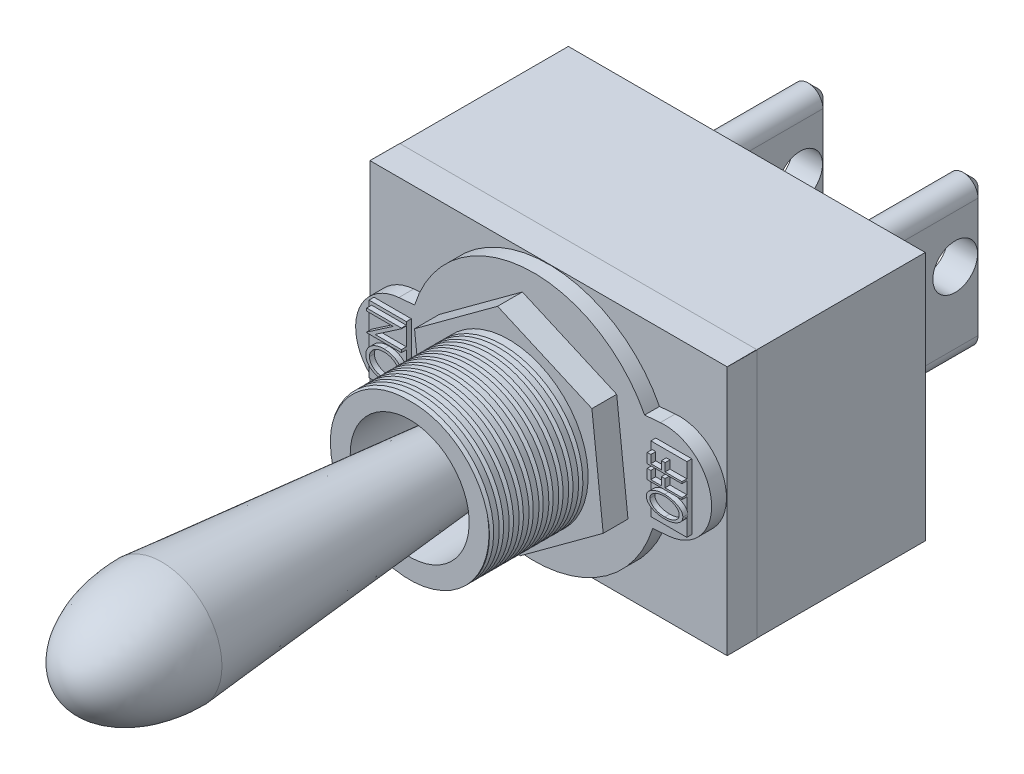
from build123d import *

# Parameters (mm, degrees)
CROQUIS1_R               = 3
SALIENTE_EXTRUIR1_DEPTH  = 35
SALIENTE_EXTRUIR1_DRAFT  = -5
CROQUIS2_R               = 8
CROQUIS2_R_2             = 6
SALIENTE_EXTRUIR2_DEPTH  = 10
CROQUIS3_R               = 8
SALIENTE_EXTRUIR3_DEPTH  = 2.5
SALIENTE_EXTRUIR4_DEPTH  = 1.5
CROQUIS5_W               = 3.766398957
CROQUIS5_H               = 6.782221943
CROQUIS5_W_2             = 3.62908354
CROQUIS5_H_2             = 6.615171576
SALIENTE_EXTRUIR5_DEPTH  = 0.5
SALIENTE_EXTRUIR6_DEPTH  = 0.5
SALIENTE_EXTRUIR7_DEPTH  = 0.5
CROQUIS10_W              = 36
CROQUIS10_H              = 25.196096164
SALIENTE_EXTRUIR8_DEPTH  = 20
CROQUIS11_W              = 36
CROQUIS11_H              = 3
SALIENTE_EXTRUIR9_DEPTH  = 0.02
SALIENTE_EXTRUIR10_DEPTH = 0.02
SALIENTE_EXTRUIR11_DEPTH = 0.02
SALIENTE_EXTRUIR12_DEPTH = 0.02
SALIENTE_EXTRUIR13_DEPTH = 15
CROQUIS17_R              = 2.256557715
CORTAR_EXTRUIR1_DEPTH    = 20
CHAFL_N1_SIZE            = 1
CORTAR_BARRER1_PITCH     = 1


with BuildPart() as part:
    # Croquis1 → Saliente-Extruir1 (with draft: the straight prism first)
    with BuildSketch(Plane.XY):
        Circle(CROQUIS1_R)
    extrude(amount=SALIENTE_EXTRUIR1_DEPTH)
    # Saliente-Extruir1: the draft: its side faces are tilted about the plane it starts from
    saliente_extruir1_sides = [part.faces().sort_by_distance(p)[0] for p in [
        (-3, 0, 17.5),
    ]]
    draft(saliente_extruir1_sides, Plane.XY, SALIENTE_EXTRUIR1_DRAFT)

    # Cúpula1: read off the stored shape, not the designer's step
    # Cúpula1 outline → Cúpula1 (revolve)
    with BuildSketch(Plane.XZ):
        with BuildLine():
            add(Edge.make_bspline(
                [(0, 45), (6.062103223, 45), (6.062103223, 35)],
                knots=[0, 0, 0, 1.570796327, 1.570796327, 1.570796327], degree=2, weights=[1, 0.707106781, 1]))
            Line((0, 45), (0, 35))
            Line((0, 35), (6.062103223, 35))
        make_face()
    revolve(axis=Axis((0, 0, 0), (0, 0, 1)))


with BuildPart() as body_2:
    # Croquis2 → Saliente-Extruir2 (new body)
    with BuildSketch(Plane(origin=(0, 0, 0), x_dir=(-1, 0, 0), z_dir=(0, 0, -1))):
        Circle(CROQUIS2_R)
        Circle(CROQUIS2_R_2, mode=Mode.SUBTRACT)
    extrude(amount=-SALIENTE_EXTRUIR2_DEPTH)

    # Cortar-Barrer1: arcs per turn and ends read off the stored shape
    # Cortar-Barrer1: the profile of Croquis20 screwed along a right-hand helix through 10 turns, 8 arcs to a turn; built about Z, then put on its axis
    cortar_barrer1_z = Axis((0, 0, 0), (0, 0, 1))
    cortar_barrer1_corners = [(7.627492064, 0, -0.5), (8.186253968, 0, -0.177398664), (8.186253968, 0, -0.822601336)]
    with BuildLine(mode=Mode.PRIVATE) as cortar_barrer1_profile:
        Line(cortar_barrer1_corners[0], cortar_barrer1_corners[1])
        Line(cortar_barrer1_corners[1], cortar_barrer1_corners[2])
        Line(cortar_barrer1_corners[2], cortar_barrer1_corners[0])
    cortar_barrer1_cap = Face(cortar_barrer1_profile.wire())
    cortar_barrer1_turn_angles = [0, 22.5, 45, 67.5, 90, 112.5, 135, 157.5, 180, 202.5, 225, 247.5, 270, 292.5, 315, 337.5, 360]
    cortar_barrer1_turn_weights = [1, 0.9238795325112867, 1, 0.9238795325112867, 1, 0.9238795325112867, 1, 0.9238795325112867, 1, 0.9238795325112867, 1, 0.9238795325112867, 1, 0.9238795325112867, 1, 0.9238795325112867, 1]
    cortar_barrer1_turn_rails = [Edge.make_bspline([Vector(p[0], p[1], 0).rotate(cortar_barrer1_z, cortar_barrer1_turn_angles[k]) / cortar_barrer1_turn_weights[k] + Vector(0, 0, p[2] + CORTAR_BARRER1_PITCH * cortar_barrer1_turn_angles[k] / 360) for k in range(17)], [0, 0, 0, 1, 1, 2, 2, 3, 3, 4, 4, 5, 5, 6, 6, 7, 7, 8, 8, 8], 2, cortar_barrer1_turn_weights) for p in cortar_barrer1_corners]
    cortar_barrer1_turn_sides = [Face.make_surface_from_curves(cortar_barrer1_turn_rails[p[0]], cortar_barrer1_turn_rails[p[1]]) for p in [(0, 1), (1, 2), (2, 0)]]
    cortar_barrer1 = Plane(origin=(0, 0, 10), x_dir=(0, -1, 0), z_dir=(0, 0, -1)) * Solid(Shell([*[p.moved(Location((0, 0, CORTAR_BARRER1_PITCH * i))) for i in range(10) for p in cortar_barrer1_turn_sides], cortar_barrer1_cap, cortar_barrer1_cap.rotate(cortar_barrer1_z, 3600).moved(Location((0, 0, CORTAR_BARRER1_PITCH * 3600 / 360)))]))
    add(cortar_barrer1, mode=Mode.SUBTRACT)


with BuildPart() as body_3:
    # Croquis3 → Saliente-Extruir3 (new body)
    with BuildSketch(Plane(origin=(0, 0, 0), x_dir=(-1, 0, 0), z_dir=(0, 0, -1))):
        Polygon((8.37751484, -6.149572758), (9.514443651, 4.180354293), (1.136928811, 10.329927051), (-8.37751484, 6.149572758), (-9.514443651, -4.180354293), (-1.136928811, -10.329927051), align=None)
        Circle(CROQUIS3_R, mode=Mode.SUBTRACT)
    extrude(amount=SALIENTE_EXTRUIR3_DEPTH)

    # Croquis4 → Saliente-Extruir4 (add)
    with BuildSketch(Plane(origin=(0, 0, -2.5), x_dir=(-1, 0, 0), z_dir=(0, 0, -1))):
        with BuildLine():
            Line((12.779751535, -5.879948052), (11.193935977, -5.743837419))
            ThreePointArc((11.193935977, -5.743837419), (-1.075920926, -12.535480251), (-12.008992426, -3.752328859))
            Line((-12.008992426, -3.752328859), (-13.594807984, -3.616218227))
            ThreePointArc((-13.594807984, -3.616218227), (-17.935362899, 1.539393137), (-12.779751535, 5.879948052))
            Line((-12.779751535, 5.879948052), (-11.193935977, 5.743837419))
            ThreePointArc((-11.193935977, 5.743837419), (1.075920926, 12.535480251), (12.008992426, 3.752328859))
            Line((12.008992426, 3.752328859), (13.594807984, 3.616218227))
            ThreePointArc((13.594807984, 3.616218227), (17.935362899, -1.539393137), (12.779751535, -5.879948052))
        make_face()
    extrude(amount=SALIENTE_EXTRUIR4_DEPTH)

    # Croquis5 → Saliente-Extruir5 (add)
    with BuildSketch(Plane.XY.offset(-2.5)):
        with Locations((-14.220250049, -1.001220863)):
            Rectangle(CROQUIS5_W, CROQUIS5_H)
        with Locations((14.141947096, 0.9957077)):
            Rectangle(CROQUIS5_W_2, CROQUIS5_H_2)
    extrude(amount=SALIENTE_EXTRUIR5_DEPTH)

    # Croquis8 → Saliente-Extruir6 (add)
    # profile 1 of 2: a face of its own
    with BuildSketch(Plane.XY.offset(-2)):
        Polygon((-12.33705057, -0.078058609), (-15.83705057, -0.078058609), (-15.83705057, -0.021267744), (-13.167879897, 1.806556775), (-15.83705057, 1.806556775), (-15.83705057, 2.075787544), (-12.33705057, 2.075787544), (-12.33705057, 2.014789948), (-14.999210026, 0.19117216), (-12.33705057, 0.19117216), align=None)
    # profile 2 of 2: a face of its own
    with BuildSketch(Plane.XY.offset(-2)):
        with BuildLine():
            add(Edge.make_bspline(
                [(-15.92679416, -2.047509731), (-15.925167912, -1.997630162), (-15.921963876, -1.899357345), (-15.896835646, -1.755178861), (-15.855169298, -1.617233023), (-15.79685654, -1.485354226), (-15.720537577, -1.360527098), (-15.629222835, -1.241238934), (-15.519784347, -1.129731157), (-15.396637046, -1.024461777), (-15.26068879, -0.929355122), (-15.115757115, -0.8454956), (-14.963131297, -0.774726201), (-14.803117743, -0.715987564), (-14.635266777, -0.671276221), (-14.459547522, -0.640267122), (-14.276604668, -0.619757887), (-14.151844327, -0.617610997), (-14.088452814, -0.616520148)],
                knots=[0, 0, 0, 0, 0.924023764, 1.820513268, 2.70292414, 3.589068843, 4.484898936, 5.408394687, 6.367133157, 7.374840499, 8.407047113, 9.437461978, 10.474166088, 11.521026438, 12.592672644, 13.688629845, 14.825578305, 16, 16, 16, 16], degree=3))
            add(Edge.make_bspline(
                [(-14.088452814, -0.616520148), (-14.025527762, -0.617607337), (-13.901697942, -0.61974681), (-13.719932137, -0.640328159), (-13.545137036, -0.671265517), (-13.377773781, -0.716064742), (-13.218150583, -0.774861549), (-13.065051472, -0.844826328), (-12.919701705, -0.928618381), (-12.783252537, -1.023988851), (-12.658542206, -1.12824317), (-12.548200184, -1.238792579), (-12.455735829, -1.356236084), (-12.378925084, -1.478491782), (-12.320484501, -1.607462682), (-12.278084286, -1.741533743), (-12.251984457, -1.881501423), (-12.248879099, -1.976818573), (-12.247306981, -2.025073834)],
                knots=[0, 0, 0, 0, 1.174878939, 2.312036986, 3.412268074, 4.48807738, 5.543123014, 6.586098547, 7.628352193, 8.672204283, 9.691639073, 10.66085683, 11.583925971, 12.47787368, 13.351042984, 14.220790417, 15.099257341, 16, 16, 16, 16], degree=3))
            add(Edge.make_bspline(
                [(-12.247306981, -2.025073834), (-12.248836099, -2.074040445), (-12.251849559, -2.170539821), (-12.278465772, -2.312131904), (-12.319187278, -2.448095039), (-12.378640204, -2.577803137), (-12.45390799, -2.70176742), (-12.546859292, -2.819486917), (-12.656350592, -2.931013992), (-12.780209615, -3.036017418), (-12.916101688, -3.131079412), (-13.060235619, -3.215353071), (-13.212372337, -3.284922974), (-13.370530428, -3.343799042), (-13.535999406, -3.388714737), (-13.708477, -3.419574215), (-13.887666121, -3.440229283), (-14.009634182, -3.442360174), (-14.071625891, -3.443443225)],
                knots=[0, 0, 0, 0, 0.916029328, 1.805235379, 2.688326709, 3.567593798, 4.468872984, 5.39761654, 6.369240692, 7.39061962, 8.433416311, 9.470616228, 10.512145238, 11.561531085, 12.627274475, 13.717256431, 14.839768611, 16, 16, 16, 16], degree=3))
            add(Edge.make_bspline(
                [(-14.071625891, -3.443443225), (-14.11324403, -3.442976168), (-14.195881265, -3.442048777), (-14.318700592, -3.432422254), (-14.439440458, -3.417861764), (-14.557842803, -3.397517523), (-14.674031219, -3.371732914), (-14.787619563, -3.339141061), (-14.899270663, -3.3016779), (-15.007573803, -3.257174296), (-15.112231327, -3.208833355), (-15.211134723, -3.15508494), (-15.304966037, -3.098763166), (-15.391958268, -3.036601695), (-15.473566619, -2.970703613), (-15.549414825, -2.900397199), (-15.61981911, -2.826202134), (-15.683226743, -2.747520116), (-15.74111207, -2.666838114), (-15.789891638, -2.582838906), (-15.832578591, -2.497885754), (-15.866827307, -2.410776659), (-15.893762316, -2.322165586), (-15.912336739, -2.232021462), (-15.925216225, -2.140428974), (-15.926265551, -2.078637728), (-15.92679416, -2.047509731)],
                knots=[0, 0, 0, 0, 1.165548892, 2.314321092, 3.448658809, 4.571166437, 5.678142732, 6.780580233, 7.879845021, 8.975145667, 10.058763506, 11.107348894, 12.126777312, 13.122170764, 14.099577622, 15.063118597, 16.017094101, 16.961792914, 17.891746868, 18.795549715, 19.679698158, 20.552529034, 21.414067769, 22.270442689, 23.128717112, 24, 24, 24, 24], degree=3))
        make_face()
        with BuildLine():
            add(Edge.make_bspline(
                [(-15.567819801, -2.035590661), (-15.567411209, -2.060401738), (-15.566594587, -2.10998969), (-15.555900397, -2.183755959), (-15.540886907, -2.25678702), (-15.518985823, -2.328574916), (-15.490471691, -2.399217409), (-15.456312676, -2.469213463), (-15.415406845, -2.538060967), (-15.368458097, -2.605255565), (-15.316045266, -2.669775281), (-15.259876603, -2.732058659), (-15.198908732, -2.790136246), (-15.133325912, -2.844177121), (-15.063715812, -2.895018646), (-14.98938323, -2.94151628), (-14.911367766, -2.985576826), (-14.828706186, -3.02445084), (-14.742709393, -3.059269731), (-14.654369557, -3.09027862), (-14.563356103, -3.116499222), (-14.469799627, -3.136972866), (-14.373980211, -3.154248837), (-14.275887688, -3.165909554), (-14.175271065, -3.173205093), (-14.107395948, -3.173873842), (-14.073028134, -3.174212456)],
                knots=[0, 0, 0, 0, 0.858002466, 1.714822191, 2.574652789, 3.436952806, 4.30812232, 5.208867668, 6.129974865, 7.076894658, 8.043271514, 9.005237682, 9.977823169, 10.954436498, 11.944588906, 12.958894923, 13.987293646, 15.043778288, 16.117736821, 17.197255143, 18.282756901, 19.393461216, 20.510509108, 21.651231977, 22.810727352, 24, 24, 24, 24], degree=3))
            add(Edge.make_bspline(
                [(-14.073028134, -3.174212456), (-14.022498355, -3.173438819), (-13.923271769, -3.17191961), (-13.777785249, -3.154968697), (-13.638012992, -3.129301391), (-13.50419034, -3.093099206), (-13.376369636, -3.045782055), (-13.254943791, -2.988127023), (-13.138950529, -2.920582693), (-13.030916331, -2.842603704), (-12.931906972, -2.757959077), (-12.844642692, -2.668003899), (-12.771744732, -2.572784751), (-12.710162033, -2.474310272), (-12.6638991, -2.370538191), (-12.630800263, -2.262719639), (-12.6094288, -2.150718826), (-12.607338215, -2.074249187), (-12.60628134, -2.035590661)],
                knots=[0, 0, 0, 0, 1.177390164, 2.312070366, 3.40945096, 4.487897548, 5.539379575, 6.582401599, 7.61769748, 8.663944349, 9.683874276, 10.651001459, 11.579421483, 12.474556249, 13.352431647, 14.219214926, 15.099740406, 16, 16, 16, 16], degree=3))
            add(Edge.make_bspline(
                [(-12.60628134, -2.035590661), (-12.606761668, -2.009621718), (-12.607716705, -1.957987672), (-12.617200813, -1.881299774), (-12.632515532, -1.805985876), (-12.654603225, -1.732290756), (-12.681653351, -1.659843261), (-12.715903948, -1.589254129), (-12.755690282, -1.520107402), (-12.801424541, -1.452647477), (-12.85241933, -1.387896581), (-12.907694637, -1.326065778), (-12.967737054, -1.268251159), (-13.032401182, -1.214135721), (-13.101931827, -1.163846086), (-13.175491175, -1.116690314), (-13.253848371, -1.073857784), (-13.336076188, -1.03490079), (-13.421775188, -0.99993204), (-13.509775861, -0.968694177), (-13.600965991, -0.944089978), (-13.693787735, -0.921644077), (-13.789485933, -0.90613042), (-13.887204195, -0.893904778), (-13.987384779, -0.886809206), (-14.055021959, -0.886105853), (-14.089153936, -0.885750917)],
                knots=[0, 0, 0, 0, 0.896721948, 1.782952137, 2.664869387, 3.54874297, 4.437910136, 5.333431969, 6.255702374, 7.191687199, 8.146186325, 9.100924421, 10.054432889, 11.022997684, 12.011280834, 13.016856859, 14.039401491, 15.093891648, 16.158348039, 17.235828393, 18.317082876, 19.419618003, 20.533182432, 21.663737741, 22.821044163, 24, 24, 24, 24], degree=3))
            add(Edge.make_bspline(
                [(-14.089153936, -0.885750917), (-14.123052203, -0.886106135), (-14.190222489, -0.886810009), (-14.289704229, -0.893900306), (-14.386717595, -0.906143643), (-14.481507242, -0.92155762), (-14.573138678, -0.944101969), (-14.662946529, -0.968672993), (-14.749703345, -1.00009394), (-14.834357888, -1.03475564), (-14.915707786, -1.073908001), (-14.99282069, -1.117500979), (-15.065896949, -1.16450743), (-15.134958961, -1.215048031), (-15.19968374, -1.269821694), (-15.259846788, -1.329096785), (-15.316849651, -1.391116638), (-15.368594224, -1.457170487), (-15.415257576, -1.525289181), (-15.456321027, -1.594964075), (-15.490637643, -1.665831757), (-15.518986869, -1.737723158), (-15.540784682, -1.810690638), (-15.555988794, -1.884845228), (-15.566581189, -1.95979796), (-15.567406724, -2.010313794), (-15.567819801, -2.035590661)],
                knots=[0, 0, 0, 0, 1.175626218, 2.329533506, 3.456621838, 4.566704408, 5.657922081, 6.727949045, 7.794500837, 8.855772102, 9.899909611, 10.923454682, 11.926279319, 12.912020837, 13.889730651, 14.864209247, 15.839698748, 16.809445853, 17.771744896, 18.701821586, 19.611793662, 20.49991299, 21.379594909, 22.249210111, 23.123948274, 24, 24, 24, 24], degree=3))
        make_face(mode=Mode.SUBTRACT)
    extrude(amount=SALIENTE_EXTRUIR6_DEPTH)

    # Croquis9 → Saliente-Extruir7 (add)
    # profile 1 of 3: a face of its own
    with BuildSketch(Plane.XY.offset(-2)):
        with BuildLine():
            add(Edge.make_bspline(
                [(12.366745276, -0.261096838), (12.368392024, -0.223105471), (12.37165951, -0.147722799), (12.39702463, -0.037173283), (12.438843099, 0.068499658), (12.49797743, 0.169005028), (12.574007082, 0.264014044), (12.666321338, 0.354245363), (12.774886842, 0.439633707), (12.898587306, 0.519373921), (13.033930408, 0.592437286), (13.179182888, 0.655308294), (13.331397597, 0.709319631), (13.491306588, 0.753897692), (13.659032986, 0.786803925), (13.834295542, 0.811546298), (14.017161672, 0.826417169), (14.141724543, 0.828226958), (14.205086622, 0.829147553)],
                knots=[0, 0, 0, 0, 0.775951109, 1.539646274, 2.305146884, 3.090814472, 3.913661617, 4.785124466, 5.723603928, 6.731868415, 7.789783054, 8.863603212, 9.963476845, 11.088780649, 12.253216896, 13.454316363, 14.705073125, 16, 16, 16, 16], degree=3))
            add(Edge.make_bspline(
                [(14.205086622, 0.829147553), (14.267981721, 0.828229674), (14.391611979, 0.826425438), (14.573306521, 0.811502163), (14.747634233, 0.786802254), (14.91490259, 0.753878072), (15.07439114, 0.709067925), (15.227306122, 0.656275939), (15.37236752, 0.592140477), (15.508898952, 0.519992313), (15.633799709, 0.441023677), (15.74350127, 0.356564173), (15.836743586, 0.267542296), (15.913434829, 0.1742944), (15.972398324, 0.075570784), (16.015095756, -0.027010467), (16.041502045, -0.134274491), (16.044648187, -0.207431188), (16.046232456, -0.244269915)],
                knots=[0, 0, 0, 0, 1.292953803, 2.541505079, 3.744926995, 4.911517055, 6.043454431, 7.148214205, 8.23469394, 9.300817335, 10.320508041, 11.269118566, 12.142459941, 12.965668698, 13.743557007, 14.497557889, 15.243431467, 16, 16, 16, 16], degree=3))
            add(Edge.make_bspline(
                [(16.046232456, -0.244269915), (16.044660613, -0.281579848), (16.041539345, -0.355667638), (16.015032344, -0.463936336), (15.973321816, -0.56779301), (15.914036303, -0.666760906), (15.838250118, -0.76121219), (15.745162409, -0.850494701), (15.635763008, -0.935152811), (15.511731365, -1.014784032), (15.376413118, -1.087849719), (15.231693489, -1.150810104), (15.080521307, -1.205033574), (14.921893105, -1.248113566), (14.756888535, -1.282708763), (14.584738596, -1.306909605), (14.405645547, -1.322012533), (14.283876627, -1.323792732), (14.221913545, -1.324698601)],
                knots=[0, 0, 0, 0, 0.769394476, 1.527816634, 2.287649639, 3.072978151, 3.900404173, 4.780794943, 5.72961358, 6.752165281, 7.820821677, 8.901125159, 10.007620329, 11.133762662, 12.292080703, 13.486265753, 14.72086636, 16, 16, 16, 16], degree=3))
            add(Edge.make_bspline(
                [(14.221913545, -1.324698601), (14.139340432, -1.322952105), (13.976561848, -1.319509191), (13.737221149, -1.29215898), (13.506785845, -1.248541855), (13.322590183, -1.195985824), (13.181853636, -1.146669375), (13.082660493, -1.105866086), (12.989516846, -1.061857587), (12.90233067, -1.014639747), (12.820335063, -0.96510338), (12.744887837, -0.910842519), (12.674554838, -0.854316703), (12.610588034, -0.794557245), (12.553382266, -0.732876105), (12.503909282, -0.669137194), (12.461450123, -0.604668616), (12.42689065, -0.538448661), (12.399880686, -0.470814911), (12.381324907, -0.401827245), (12.368343228, -0.331929249), (12.367279114, -0.284760269), (12.366745276, -0.261096838)],
                knots=[0, 0, 0, 0, 2.118633724, 4.176519287, 6.173844241, 8.131319736, 9.085486674, 9.999919159, 10.882584443, 11.727923929, 12.543637184, 13.339167661, 14.111012757, 14.857868562, 15.583692954, 16.267539326, 16.926307387, 17.562094998, 18.181344225, 18.79102161, 19.393487487, 20, 20, 20, 20], degree=3))
        make_face()
        with BuildLine():
            add(Edge.make_bspline(
                [(12.725719635, -0.251982255), (12.726146585, -0.271425818), (12.727006013, -0.310564742), (12.737568378, -0.368506141), (12.752831518, -0.425910288), (12.774859801, -0.482250386), (12.803103468, -0.537845595), (12.837696393, -0.592690206), (12.878634737, -0.646735738), (12.925358813, -0.699856512), (12.977872468, -0.750399254), (13.034166016, -0.799301508), (13.095068495, -0.844807862), (13.160875443, -0.886630031), (13.230077184, -0.927201745), (13.304715792, -0.962813165), (13.382568784, -0.99793634), (13.493804309, -1.038821818), (13.640657277, -1.081645648), (13.825415716, -1.118857066), (14.019936212, -1.140637586), (14.152681167, -1.14366465), (14.220511302, -1.145211421)],
                knots=[0, 0, 0, 0, 0.610946608, 1.229805085, 1.846914134, 2.477711434, 3.128750641, 3.80599803, 4.514758333, 5.25966334, 6.029161853, 6.805897024, 7.604354843, 8.418068741, 9.257966983, 10.126033098, 11.018115194, 11.944034219, 13.851802939, 15.824322434, 17.866308567, 20, 20, 20, 20], degree=3))
            add(Edge.make_bspline(
                [(14.220511302, -1.145211421), (14.271014046, -1.144368272), (14.37005947, -1.142714696), (14.515501648, -1.130782683), (14.655062016, -1.110397562), (14.788728277, -1.082100891), (14.916232604, -1.044459), (15.037928032, -1.00001735), (15.153211206, -0.946195064), (15.261872146, -0.88611423), (15.360688942, -0.819514357), (15.447445241, -0.748731641), (15.521234048, -0.674655206), (15.58239901, -0.597536341), (15.629414348, -0.51597144), (15.662423998, -0.430829789), (15.684049625, -0.342567102), (15.68618586, -0.282254743), (15.687258097, -0.251982255)],
                knots=[0, 0, 0, 0, 1.285849575, 2.521793965, 3.712605619, 4.875082945, 5.997387847, 7.095048241, 8.170663086, 9.233577513, 10.253564951, 11.200644639, 12.080082557, 12.910969024, 13.699993933, 14.466897345, 15.230492181, 16, 16, 16, 16], degree=3))
            add(Edge.make_bspline(
                [(15.687258097, -0.251982255), (15.686768399, -0.231615885), (15.685789649, -0.190910015), (15.676327033, -0.13050608), (15.660939531, -0.071263712), (15.638883112, -0.013648361), (15.61131345, 0.042956409), (15.577639328, 0.098445566), (15.537130838, 0.152352004), (15.491892579, 0.205705665), (15.440667664, 0.256417132), (15.385436255, 0.305016763), (15.32507764, 0.349926051), (15.26086702, 0.392966387), (15.191156542, 0.431872797), (15.117457098, 0.468393021), (15.03932084, 0.502177994), (14.928463924, 0.54320767), (14.782370821, 0.587321231), (14.597914454, 0.622711758), (14.404349616, 0.64629962), (14.272000228, 0.648523988), (14.204385501, 0.649660373)],
                knots=[0, 0, 0, 0, 0.640275216, 1.279705741, 1.918078831, 2.562560893, 3.216863883, 3.896450679, 4.600759172, 5.335967829, 6.09494158, 6.866066466, 7.648290749, 8.459815304, 9.296006686, 10.157413596, 11.046485397, 11.972335097, 13.874996332, 15.838717404, 17.874081668, 20, 20, 20, 20], degree=3))
            add(Edge.make_bspline(
                [(14.204385501, 0.649660373), (14.137239871, 0.64851424), (14.005825729, 0.646271082), (13.814083066, 0.622883568), (13.631795193, 0.587154197), (13.487690335, 0.543399651), (13.378411131, 0.501967289), (13.300908471, 0.468583581), (13.228326039, 0.431004001), (13.158758384, 0.392216823), (13.094793975, 0.348326078), (13.033813015, 0.302694923), (12.977196851, 0.253888392), (12.925372772, 0.201925181), (12.878579456, 0.148410479), (12.83768982, 0.093615321), (12.803082265, 0.038080875), (12.77486923, -0.018224808), (12.752677069, -0.075454325), (12.737768816, -0.133640934), (12.726893952, -0.192451567), (12.726112492, -0.232066793), (12.725719635, -0.251982255)],
                knots=[0, 0, 0, 0, 2.120282987, 4.149714133, 6.092901993, 7.982513085, 8.898514178, 9.78462904, 10.646449341, 11.479810353, 12.298920316, 13.094841777, 13.885265053, 14.657937066, 15.411536634, 16.129196082, 16.815561819, 17.475941128, 18.116287759, 18.750260495, 19.371727952, 20, 20, 20, 20], degree=3))
        make_face(mode=Mode.SUBTRACT)
    # profile 2 of 3: a face of its own
    with BuildSketch(Plane.XY.offset(-2)):
        Polygon((12.456488866, 1.232993707), (12.456488866, 2.220173194), (12.815463225, 2.220173194), (12.815463225, 1.412480886), (13.892386302, 1.412480886), (13.892386302, 2.220173194), (14.251360661, 2.220173194), (14.251360661, 1.412480886), (15.956488866, 1.412480886), (15.956488866, 1.232993707), align=None)
    # profile 3 of 3: a face of its own
    with BuildSketch(Plane.XY.offset(-2)):
        Polygon((12.456488866, 2.624019348), (12.456488866, 3.611198835), (12.815463225, 3.611198835), (12.815463225, 2.803506527), (13.892386302, 2.803506527), (13.892386302, 3.611198835), (14.251360661, 3.611198835), (14.251360661, 2.803506527), (15.956488866, 2.803506527), (15.956488866, 2.624019348), align=None)
    extrude(amount=SALIENTE_EXTRUIR7_DEPTH)

    # Croquis10 → Saliente-Extruir8 (add)
    with BuildSketch(Plane(origin=(0, 0, -4), x_dir=(-1, 0, 0), z_dir=(0, 0, -1))):
        Rectangle(CROQUIS10_W, CROQUIS10_H)
    extrude(amount=SALIENTE_EXTRUIR8_DEPTH)

    # Croquis11 → Saliente-Extruir9 (add)
    with BuildSketch(Plane.XZ.offset(12.598048082)):
        with Locations((0, -5.5)):
            Rectangle(CROQUIS11_W, CROQUIS11_H)
    extrude(amount=SALIENTE_EXTRUIR9_DEPTH)

    # Croquis12 → Saliente-Extruir10 (add)
    with BuildSketch(Plane(origin=(18, 0, 0), x_dir=(0, 0, -1), z_dir=(1, 0, 0))):
        Polygon((4, -12.618048082), (6.999933333, -12.598048082), (6.999933333, 12.598048082), (4, 12.598048082), align=None)
    extrude(amount=SALIENTE_EXTRUIR10_DEPTH)

    # Croquis13 → Saliente-Extruir11 (add)
    with BuildSketch(Plane(origin=(0, 12.598048082, 0), x_dir=(1, 0, 0), z_dir=(0, 1, 0))):
        Polygon((18.02, 4), (18, 6.999933333), (-18, 7), (-18, 4), align=None)
    extrude(amount=SALIENTE_EXTRUIR11_DEPTH)

    # Croquis15 → Saliente-Extruir12 (add)
    with BuildSketch(Plane.ZY.offset(18)):
        Polygon((-4, 12.618048082), (-7, 12.598048082), (-7, -12.598048082), (-4, -12.618048082), align=None)
    extrude(amount=SALIENTE_EXTRUIR12_DEPTH)

    # Croquis16 → Saliente-Extruir13 (add)
    with BuildSketch(Plane(origin=(0, 0, -24), x_dir=(-1, 0, 0), z_dir=(0, 0, -1))):
        with BuildLine():
            Line((9.320427823, 6), (9.320427823, -6))
            ThreePointArc((9.320427823, -6), (7.820427823, -7.5), (6.320427823, -6))
            Line((6.320427823, -6), (6.320427823, 6))
            ThreePointArc((6.320427823, 6), (7.820427823, 7.5), (9.320427823, 6))
        make_face()
        with BuildLine():
            Line((-9.320427823, 6), (-9.320427823, -6))
            ThreePointArc((-9.320427823, -6), (-7.820427823, -7.5), (-6.320427823, -6))
            Line((-6.320427823, -6), (-6.320427823, 6))
            ThreePointArc((-6.320427823, 6), (-7.820427823, 7.5), (-9.320427823, 6))
        make_face()
    extrude(amount=SALIENTE_EXTRUIR13_DEPTH)

    # Croquis17 → Cortar-Extruir1 (cut)
    with BuildSketch(Plane.ZY.offset(9.320427823)):
        with Locations(Location((-35.698717467, 1.173372232, 0), (0, 0, 270))):
            Circle(CROQUIS17_R)
    extrude(amount=-CORTAR_EXTRUIR1_DEPTH, mode=Mode.SUBTRACT)

    # Chaflán1
    chafl_n1_edges = [body_3.edges().sort_by_distance(p)[0] for p in [
        (-7.820427823, 7.5, -39),
        (-6.320427823, 0, -39),
        (-7.820427823, -7.5, -39),
        (-9.320427823, 0, -39),
        (7.820427823, 7.5, -39),
        (9.320427823, 0, -39),
        (7.820427823, -7.5, -39),
        (6.320427823, 0, -39),
    ]]
    chamfer(chafl_n1_edges, length=CHAFL_N1_SIZE)


solid = Compound([part.part, body_2.part, body_3.part])
